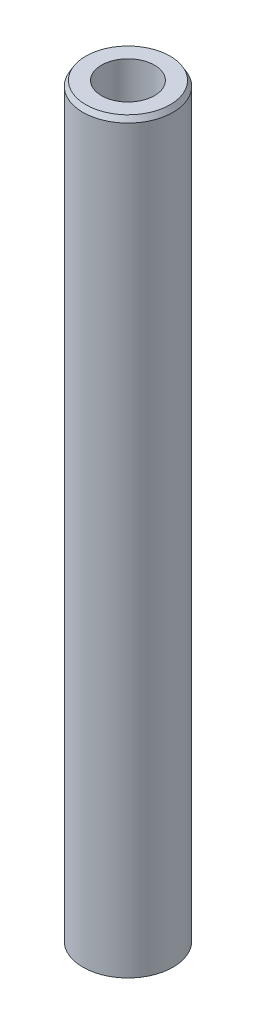
from build123d import *
from OCP.BRepFilletAPI import BRepFilletAPI_MakeChamfer

# Parameters (mm, degrees)
SKETCH1_R           = 35
BOSS_EXTRUDE1_DEPTH = 580.890931569
SKETCH2_R           = 20.555002783
CUT_EXTRUDE1_DEPTH  = 583.995947138
CHAMFER1_SIZE       = 3.964764201
CHAMFER1_SIZE2      = 2.289057679


with BuildPart() as part:
    # Sketch1 → Boss-Extrude1 (new body)
    with BuildSketch(Plane(origin=(0, 0, 0), x_dir=(1, 0, 0), z_dir=(0, 1, 0))):
        Circle(SKETCH1_R)
    extrude(amount=BOSS_EXTRUDE1_DEPTH)

    # Sketch2 → Cut-Extrude1 (cut, through all)
    with BuildSketch(Plane(origin=(0, 0, 0), x_dir=(1, 0, 0), z_dir=(0, 1, 0))):
        Circle(SKETCH2_R)
    extrude(amount=CUT_EXTRUDE1_DEPTH, mode=Mode.SUBTRACT)

    # Chamfer1: one chamfer whose edges measure the first distance from different faces: ONE call of the kernel's chamfer builder (chamfer() names one face for all edges)
    chamfer1_edges_1 = [part.edges().sort_by_distance(p)[0] for p in [
        (-35, 580.890931569, 0),
    ]]
    chamfer1_side_1 = [part.faces().sort_by_distance(p)[0] for p in [
        (-35, 290.445465784, 0),
    ]]
    chamfer1_edges_2 = [part.edges().sort_by_distance(p)[0] for p in [
        (-35, 0, 0),
    ]]
    chamfer1_side_2 = [part.faces().sort_by_distance(p)[0] for p in [
        (-34.010050506, 0, 0),
    ]]
    chamfer1 = BRepFilletAPI_MakeChamfer(part.part.solid().wrapped)
    for e in chamfer1_edges_1:
        chamfer1.Add(CHAMFER1_SIZE, CHAMFER1_SIZE2, e.wrapped, chamfer1_side_1[0].wrapped)  # the first distance lies on this face
    for e in chamfer1_edges_2:
        chamfer1.Add(CHAMFER1_SIZE, CHAMFER1_SIZE2, e.wrapped, chamfer1_side_2[0].wrapped)  # the first distance lies on this face
    add(Compound.cast(chamfer1.Shape()), mode=Mode.REPLACE)


solid = part.part
